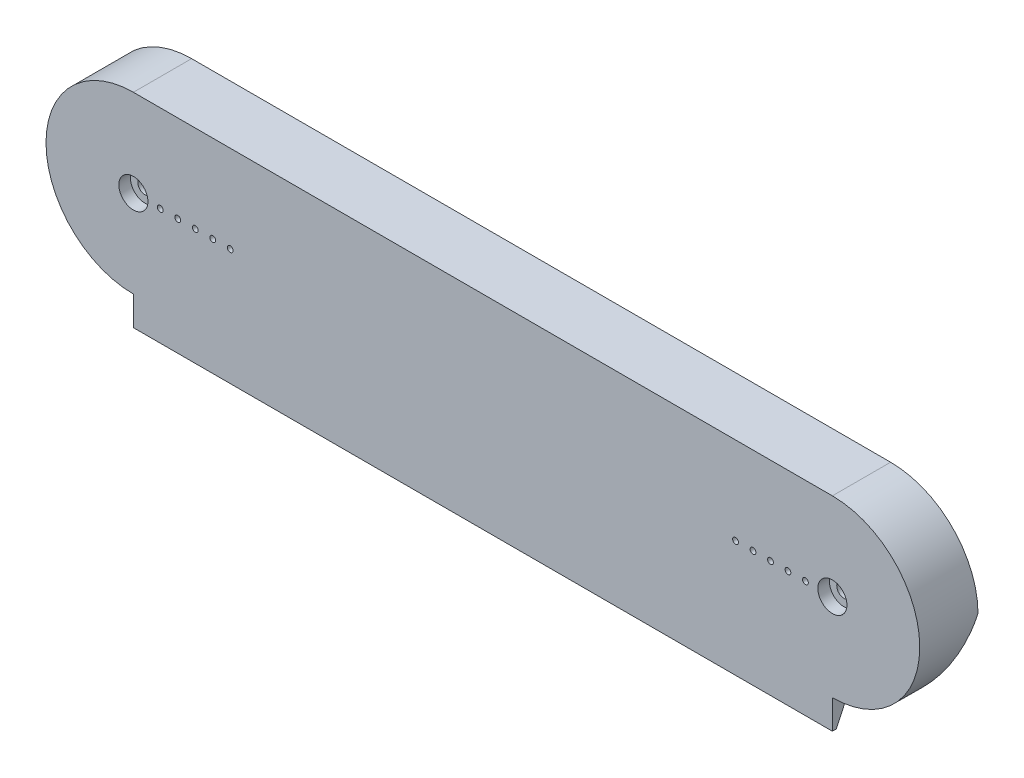
from build123d import *

# Parameters (mm, degrees)
BOSS_EXTRUDE1_DEPTH = 10
CUT_EXTRUDE1_DEPTH  = 5
SKETCH3_R           = 0.5
SKETCH3_R_2         = 1.25
CUT_EXTRUDE2_DEPTH  = 5
SKETCH5_R           = 2.5
CUT_EXTRUDE3_DEPTH  = 2
CHAMFER1_SIZE       = 20
CHAMFER1_SIZE_2     = 9.326153163


with BuildPart() as part:
    # Sketch1 → Boss-Extrude1 (new body)
    with BuildSketch(Plane.XY):
        with BuildLine():
            Line((0, 15), (120, 15))
            ThreePointArc((120, 15), (135, 0), (120, -15))
            Line((120, -15), (120, -20))
            Line((120, -20), (0, -20))
            Line((0, -20), (0, -15))
            ThreePointArc((0, -15), (-15, 0), (0, 15))
        make_face()
    extrude(amount=BOSS_EXTRUDE1_DEPTH)

    # Sketch2 → Cut-Extrude1 (cut)
    with BuildSketch(Plane(origin=(0, 0, 0), x_dir=(-1, 0, 0), z_dir=(0, 0, -1))):
        with BuildLine():
            Line((-119.664370079, 3.860437482), (-103.908464567, 2.490604827))
            ThreePointArc((-103.908464567, 2.490604827), (-101.625, 0), (-103.908464567, -2.490604827))
            Line((-103.908464567, -2.490604827), (-119.664370079, -3.860437482))
            ThreePointArc((-119.664370079, -3.860437482), (-123.875, 0), (-119.664370079, 3.860437482))
        make_face()
    cut_extrude1 = extrude(amount=-CUT_EXTRUDE1_DEPTH, mode=Mode.SUBTRACT)

    # Sketch3 → Cut-Extrude2 (cut)
    with BuildSketch(Plane(origin=(0, 0, 5), x_dir=(-1, 0, 0), z_dir=(0, 0, -1))):
        with Locations((-115.375, 0)):
            Circle(SKETCH3_R)
        with Locations((-112.375, 0)):
            Circle(SKETCH3_R)
        with Locations((-109.375, 0)):
            Circle(SKETCH3_R)
        with Locations((-106.375, 0)):
            Circle(SKETCH3_R)
        with Locations((-103.375, 0)):
            Circle(SKETCH3_R)
        with Locations((-120, 0)):
            Circle(SKETCH3_R_2)
    cut_extrude2 = extrude(amount=-CUT_EXTRUDE2_DEPTH, mode=Mode.SUBTRACT)

    # Sketch5 → Cut-Extrude3 (cut)
    with BuildSketch(Plane.XY.offset(10)):
        with Locations((120, 0)):
            Circle(SKETCH5_R)
    cut_extrude3 = extrude(amount=-CUT_EXTRUDE3_DEPTH, mode=Mode.SUBTRACT)

    # Mirror1: Cut-Extrude1, Cut-Extrude2, Cut-Extrude3 across plane
    add(cut_extrude1.mirror(Plane(origin=(60, 0, 0), x_dir=(0, 0, 1), z_dir=(1, 0, 0))), mode=Mode.SUBTRACT)
    add(cut_extrude2.mirror(Plane(origin=(60, 0, 0), x_dir=(0, 0, 1), z_dir=(1, 0, 0))), mode=Mode.SUBTRACT)
    add(cut_extrude3.mirror(Plane(origin=(60, 0, 0), x_dir=(0, 0, 1), z_dir=(1, 0, 0))), mode=Mode.SUBTRACT)

    # Chamfer1
    # the kernel refuses this chamfer: 20, 9.326153163 mm, written as the material it takes off along each edge
    with BuildSketch(Plane(origin=(171.819509428, -20, 0), x_dir=(0, 0.9998669641130704, -0.016311164131110348), z_dir=(-1, 0, 0))) as chamfer1_piece_1:
        Polygon((CHAMFER1_SIZE * 0.999866964113, -CHAMFER1_SIZE * 0.0163111641311), (-CHAMFER1_SIZE_2 * 0.0163111641313, -CHAMFER1_SIZE_2 * 0.999866964124), (0, 0), align=None)
    extrude(amount=223.639018857, mode=Mode.SUBTRACT)


solid = part.part
